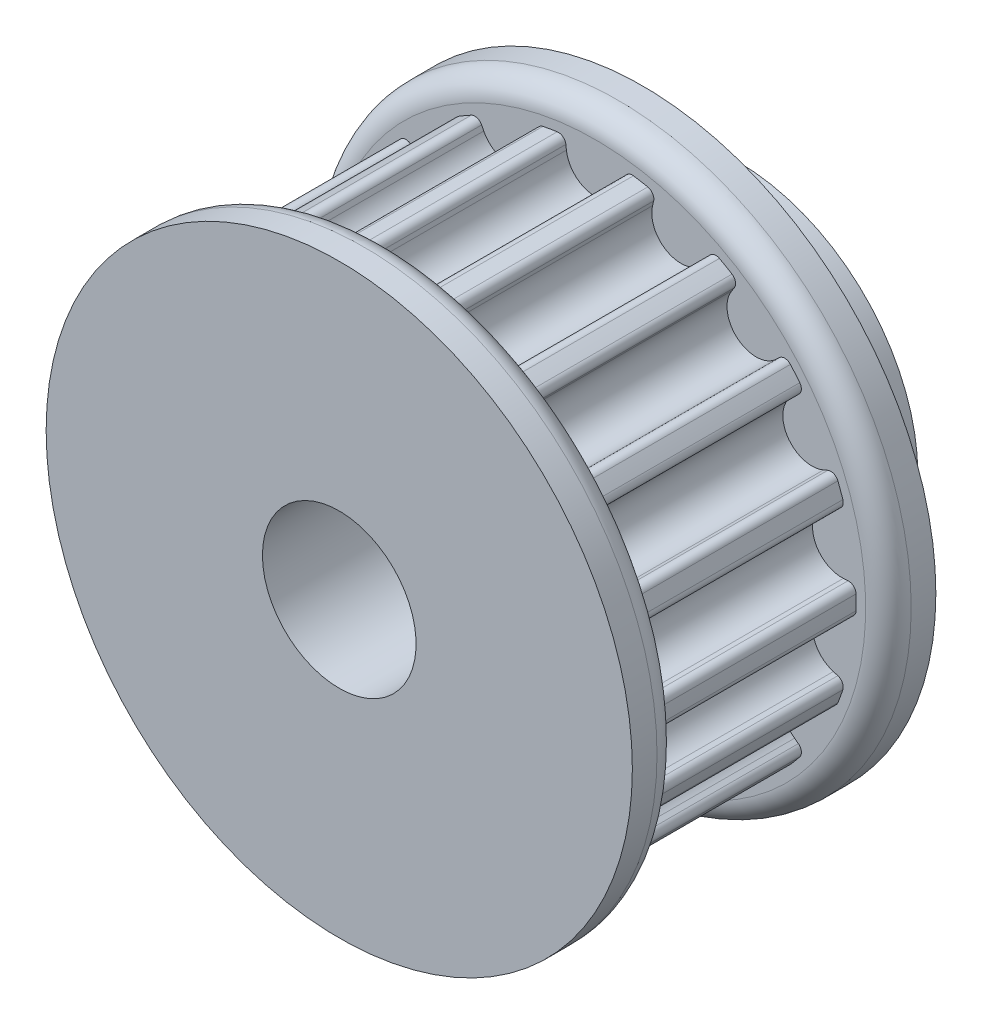
from build123d import *

# Parameters (mm, degrees)
SKETCH_3_R                       = 13.752444878
EXTRUDE_2_DEPTH                  = 5.5
CUT_EXTRUDE_2_DEPTH              = 21.211617458
FILLET_1_R                       = 0.4
PATTERN_CIRCULAR_1_COUNT         = 18
FILLET_1_OF_PATTERN_CIRCULAR_1_R = 0.4
SKETCH_12_R                      = 15.452444878
EXTRUDE_4_DEPTH                  = 2.5
EXTRUDE_START                    = 2.5
SKETCH_13_R                      = 15.452444878
EXTRUDE_5_DEPTH                  = 2.5
FILLET_2_R                       = 1.2
SKETCH_5_R                       = 9.5
EXTRUDE_3_DEPTH                  = 5
SKETCH_4_R                       = 4.05
CUT_EXTRUDE_3_DEPTH              = 31.307690533
SKETCH_8_W                       = 1.5
SKETCH_8_H                       = 15.452444878


with BuildPart() as part:
    # 스케치3 → 보스-돌출2 (new, symmetric)
    with BuildSketch(Plane.XY):
        Circle(SKETCH_3_R)
    extrude(amount=EXTRUDE_2_DEPTH, both=True)

    # 스케치3<3> → 컷-돌출2 (cut, symmetric)
    with BuildSketch(Plane.XY):
        with BuildLine():
            Line((-1.600765204, 13.658963756), (-1.524565963, 13.008773041))
            ThreePointArc((-1.524565963, 13.008773041), (0, 11.652444878), (1.524565963, 13.008773041))
            Line((1.524565963, 13.008773041), (1.600765204, 13.658963756))
            ThreePointArc((1.600765204, 13.658963756), (0, 13.752444878), (-1.600765204, 13.658963756))
        make_face()
    cut_extrude_2 = extrude(amount=CUT_EXTRUDE_2_DEPTH, both=True, mode=Mode.SUBTRACT)

    # 필렛1
    fillet_1_edges = [part.edges().sort_by_distance(p)[0] for p in [
        (1.600765204, 13.658963756, 0),
        (-1.600765204, 13.658963756, 0),
    ]]
    fillet(fillet_1_edges, radius=FILLET_1_R)

    # 원형 패턴1: 컷-돌출2 ×18 about axis
    pattern_circular_1_axis = Axis((0, 0, 5.5), (0, 0, -1))
    for i in range(1, PATTERN_CIRCULAR_1_COUNT):
        add(cut_extrude_2.rotate(pattern_circular_1_axis, i * 360 / PATTERN_CIRCULAR_1_COUNT), mode=Mode.SUBTRACT)

    # 필렛1 of 원형 패턴1
    fillet_1_of_pattern_circular_1_edges = [part.edges().sort_by_distance(p)[0] for p in [
        (6.175867991, 12.287733505, 0),
        (3.167413492, 13.382721394, 0),
        (10.006069953, 9.434421245, 0),
        (7.553555375, 11.492325323, 0),
        (12.629392204, 5.443178546, 0),
        (11.028627, 8.21578521, 0),
        (13.729423366, 0.795408182, 0),
        (13.173483445, 3.948300149, 0),
        (13.173483445, -3.948300149, 0),
        (13.729423366, -0.795408182, 0),
        (11.028627, -8.21578521, 0),
        (12.629392204, -5.443178546, 0),
        (7.553555375, -11.492325323, 0),
        (10.006069953, -9.434421245, 0),
        (3.167413492, -13.382721394, 0),
        (6.175867991, -12.287733505, 0),
        (-1.600765204, -13.658963756, 0),
        (1.600765204, -13.658963756, 0),
        (-6.175867991, -12.287733505, 0),
        (-3.167413492, -13.382721394, 0),
        (-10.006069953, -9.434421245, 0),
        (-7.553555375, -11.492325323, 0),
        (-12.629392204, -5.443178546, 0),
        (-11.028627, -8.21578521, 0),
        (-13.729423366, -0.795408182, 0),
        (-13.173483445, -3.948300149, 0),
        (-13.173483445, 3.948300149, 0),
        (-13.729423366, 0.795408182, 0),
        (-11.028627, 8.21578521, 0),
        (-12.629392204, 5.443178546, 0),
        (-7.553555375, 11.492325323, 0),
        (-10.006069953, 9.434421245, 0),
        (-3.167413492, 13.382721394, 0),
        (-6.175867991, 12.287733505, 0),
    ]]
    fillet(fillet_1_of_pattern_circular_1_edges, radius=FILLET_1_OF_PATTERN_CIRCULAR_1_R)

    # 스케치12 → 보스-돌출4 (add)
    with BuildSketch(Plane.XY.offset(5.5)):
        Circle(SKETCH_12_R)
    extrude(amount=EXTRUDE_4_DEPTH)

    # 스케치13 → 보스-돌출5 (add)
    with BuildSketch(Plane(origin=(0, 0, -5.5), x_dir=(-1, 0, 0), z_dir=(0, 0, -1)).offset(EXTRUDE_START)):
        Circle(SKETCH_13_R)
    extrude(amount=-EXTRUDE_5_DEPTH)

    # 필렛2
    fillet_2_edges = [part.edges().sort_by_distance(p)[0] for p in [
        (-15.452444878, 0, 5.5),
        (15.452444878, 0, -5.5),
    ]]
    fillet(fillet_2_edges, radius=FILLET_2_R)

    # 스케치5 → 보스-돌출3 (add)
    with BuildSketch(Plane(origin=(0, 0, -8), x_dir=(-1, 0, 0), z_dir=(0, 0, -1))):
        Circle(SKETCH_5_R)
    extrude(amount=EXTRUDE_3_DEPTH)

    # 스케치4 → 컷-돌출3 (cut, through all)
    with BuildSketch(Plane(origin=(0, 0, 8), x_dir=(-1, 0, 0), z_dir=(0, 0, -1))):
        Circle(SKETCH_4_R)
    extrude(amount=CUT_EXTRUDE_3_DEPTH, mode=Mode.SUBTRACT)

    # 스케치8 → M4x0.7 탭을 위한 탭 드릴1 (revolve, cut)
    with BuildSketch(Plane(origin=(0, 0, -10.5), x_dir=(0, 0, -1), z_dir=(1, 0, 0))):
        with Locations((0.75, 7.726222439)):
            Rectangle(SKETCH_8_W, SKETCH_8_H)
    revolve(axis=Axis((0, -6.35, -10.5), (0, 1, 0)), mode=Mode.SUBTRACT)


solid = part.part
